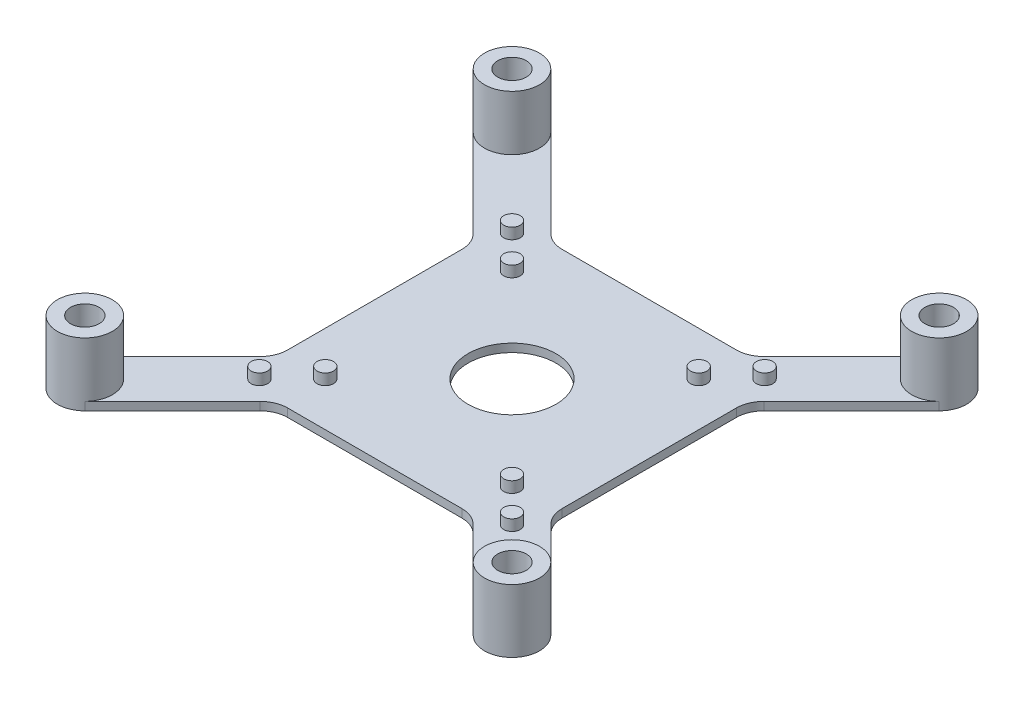
from build123d import *

# Parameters (mm, degrees)
SKETCH1_W           = 50
SKETCH1_H           = 50
SKETCH1_R           = 8
BOSS_EXTRUDE1_DEPTH = 1.5
SKETCH4_R           = 1.5
BOSS_EXTRUDE2_DEPTH = 2
BOSS_EXTRUDE3_START = -1.5
SKETCH5_R           = 2.6
SKETCH5_R_2         = 8
BOSS_EXTRUDE3_DEPTH = 1.5
FILLET1_R           = 5
SKETCH6_R           = 5
SKETCH6_R_2         = 2.6
BOSS_EXTRUDE4_DEPTH = 10


with BuildPart() as part:
    # Sketch1 → Boss-Extrude1 (new body)
    with BuildSketch(Plane(origin=(0, 0, 0), x_dir=(1, 0, 0), z_dir=(0, 1, 0))):
        Rectangle(SKETCH1_W, SKETCH1_H)
        with Locations(Location((0, 0, 0), (0, 0, 270))):
            Circle(SKETCH1_R, mode=Mode.SUBTRACT)
    extrude(amount=BOSS_EXTRUDE1_DEPTH)

    # Sketch4 → Boss-Extrude2 (add)
    with BuildSketch(Plane(origin=(0, 1.5, 0), x_dir=(1, 0, 0), z_dir=(0, 1, 0))):
        with Locations(Location((-23, 23, 0), (0, 0, 90))):
            Circle(SKETCH4_R)
        with Locations(Location((-17, 17, 0), (0, 0, 90))):
            Circle(SKETCH4_R)
        with Locations(Location((17, 17, 0), (0, 0, 90))):
            Circle(SKETCH4_R)
        with Locations(Location((23, 23, 0), (0, 0, 90))):
            Circle(SKETCH4_R)
        with Locations(Location((-17, -17, 0), (0, 0, 90))):
            Circle(SKETCH4_R)
        with Locations(Location((-23, -23, 0), (0, 0, 90))):
            Circle(SKETCH4_R)
        with Locations(Location((17, -17, 0), (0, 0, 90))):
            Circle(SKETCH4_R)
        with Locations(Location((23, -23, 0), (0, 0, 90))):
            Circle(SKETCH4_R)
    extrude(amount=BOSS_EXTRUDE2_DEPTH)

    # Sketch5 → Boss-Extrude3 (add)
    with BuildSketch(Plane(origin=(0, 1.5, 0), x_dir=(1, 0, 0), z_dir=(0, 1, 0)).offset(BOSS_EXTRUDE3_START)):
        Polygon((-42.426406871, -35.355339059), (-25, -17.928932188), (-25, 17.928932188), (-42.426406871, 35.355339059), (-45.961940777, 38.890872965), (-38.890872965, 45.961940777), (-35.355339059, 42.426406871), (-17.928932188, 25), (17.928932188, 25), (35.355339059, 42.426406871), (38.890872965, 45.961940777), (45.961940777, 38.890872965), (42.426406871, 35.355339059), (25, 17.928932188), (25, -17.928932188), (42.426406871, -35.355339059), (45.961940777, -38.890872965), (38.890872965, -45.961940777), (35.355339059, -42.426406871), (17.928932188, -25), (-17.928932188, -25), (-35.355339059, -42.426406871), (-38.890872965, -45.961940777), (-45.961940777, -38.890872965), align=None)
        with Locations(Location((-38.890872965, -38.890872965, 0), (0, 0, 270))):
            Circle(SKETCH5_R, mode=Mode.SUBTRACT)
        with Locations(Location((38.890872965, 38.890872965, 0), (0, 0, 270))):
            Circle(SKETCH5_R, mode=Mode.SUBTRACT)
        with Locations(Location((38.890872965, -38.890872965, 0), (0, 0, 90))):
            Circle(SKETCH5_R, mode=Mode.SUBTRACT)
        with Locations(Location((-38.890872965, 38.890872965, 0), (0, 0, 90))):
            Circle(SKETCH5_R, mode=Mode.SUBTRACT)
        with Locations(Location((0, 0, 0), (0, 0, 270))):
            Circle(SKETCH5_R_2, mode=Mode.SUBTRACT)
    extrude(amount=BOSS_EXTRUDE3_DEPTH)

    # Fillet1
    fillet1_edges = [part.edges().sort_by_distance(p)[0] for p in [
        (17.928932188, 0.75, 25),
        (38.890872965, 0.75, 45.961940777),
        (45.961940777, 0.75, 38.890872965),
        (25, 0.75, 17.928932188),
        (25, 0.75, -17.928932188),
        (45.961940777, 0.75, -38.890872965),
        (38.890872965, 0.75, -45.961940777),
        (17.928932188, 0.75, -25),
        (-17.928932188, 0.75, -25),
        (-38.890872965, 0.75, -45.961940777),
        (-45.961940777, 0.75, -38.890872965),
        (-25, 0.75, -17.928932188),
        (-25, 0.75, 17.928932188),
        (-45.961940777, 0.75, 38.890872965),
        (-38.890872965, 0.75, 45.961940777),
        (-17.928932188, 0.75, 25),
    ]]
    fillet(fillet1_edges, radius=FILLET1_R - 0.0001)  # a hair under: the kernel refuses the full size

    # Sketch6 → Boss-Extrude4 (add)
    # profile 1 of 4: a face of its own
    with BuildSketch(Plane(origin=(0, 1.5, 0), x_dir=(1, 0, 0), z_dir=(0, 1, 0))):
        with Locations(Location((-38.890872965, -38.890872965, 0), (0, 0, 270))):
            Circle(SKETCH6_R)
        with Locations(Location((-38.890872965, -38.890872965, 0), (0, 0, 270))):
            Circle(SKETCH6_R_2, mode=Mode.SUBTRACT)
    # profile 2 of 4: a face of its own
    with BuildSketch(Plane(origin=(0, 1.5, 0), x_dir=(1, 0, 0), z_dir=(0, 1, 0))):
        with Locations(Location((-38.890872965, 38.890872965, 0), (0, 0, 270))):
            Circle(SKETCH6_R)
        with Locations(Location((-38.890872965, 38.890872965, 0), (0, 0, 270))):
            Circle(SKETCH6_R_2, mode=Mode.SUBTRACT)
    # profile 3 of 4: a face of its own
    with BuildSketch(Plane(origin=(0, 1.5, 0), x_dir=(1, 0, 0), z_dir=(0, 1, 0))):
        with Locations(Location((38.890872965, 38.890872965, 0), (0, 0, 270))):
            Circle(SKETCH6_R)
        with Locations(Location((38.890872965, 38.890872965, 0), (0, 0, 270))):
            Circle(SKETCH6_R_2, mode=Mode.SUBTRACT)
    # profile 4 of 4: a face of its own
    with BuildSketch(Plane(origin=(0, 1.5, 0), x_dir=(1, 0, 0), z_dir=(0, 1, 0))):
        with Locations(Location((38.890872965, -38.890872965, 0), (0, 0, 270))):
            Circle(SKETCH6_R)
        with Locations(Location((38.890872965, -38.890872965, 0), (0, 0, 270))):
            Circle(SKETCH6_R_2, mode=Mode.SUBTRACT)
    extrude(amount=BOSS_EXTRUDE4_DEPTH)


solid = part.part
